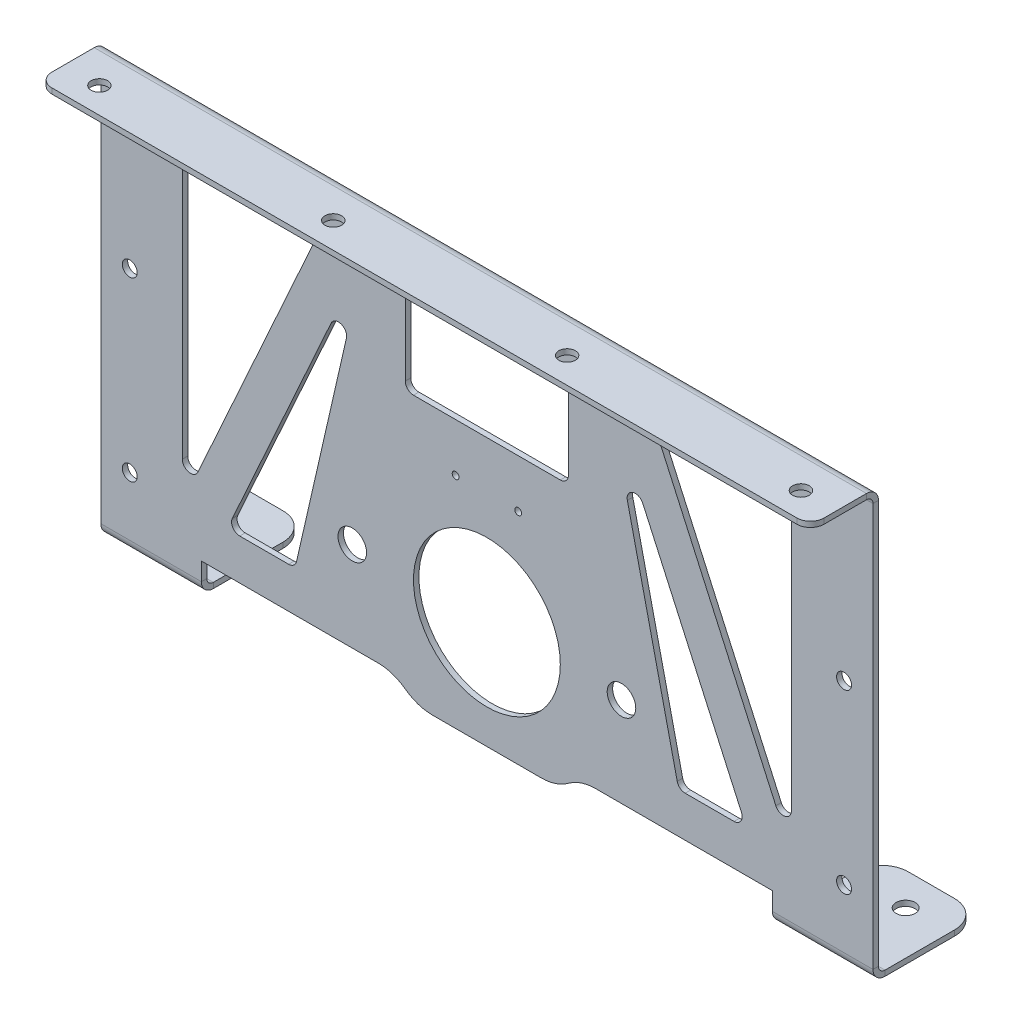
from build123d import *

# Parameters (mm, degrees)
SM_START                     = -142
SM_BASE_FLANGE_1_DEPTH       = 284
SKETCH_6_R                   = 27
CUT_EXTRUDE_1_DEPTH          = 10
HOLE_WIZARD_5_5_5_5_1_D      = 5.5
HOLE_WIZARD_5_5_5_5_1_DEPTH  = 14
HOLE_WIZARD_5_5_5_5_1_TIP    = 1.652366702
HOLE_WIZARD_7_0_7_1_D        = 7
SKETCH_21_W                  = 210
SKETCH_21_H                  = 11
CUT_EXTRUDE_4_DEPTH          = 213.395480178
FILLET_1_R                   = 10
HOLE_WIZARD_M31_D            = 2.5
HOLE_WIZARD_M31_DEPTH        = 8.5
HOLE_WIZARD_M31_TIP          = 0.751075774
SM_EDGE_FLANGE_1_DEPTH       = 284
FILLET_3_R                   = 5
EXTRUDE_1_DEPTH              = 2
CUT_EXTRUDE_5_DEPTH          = 10
HOLE_WIZARD_6_1_6_1_1_D      = 6.1
HOLE_WIZARD_6_1_6_1_1_DEPTH  = 7.25
HOLE_WIZARD_6_1_6_1_1_TIP    = 1.832624888
F_10_5_10_5_DIAMETER_HOLE1_D = 10.5


# Read off the part's stored shape, not the designer's step: Базовая кромка1
# Sheet-metal steps are written as plain solids
with BuildPart() as part:
    # Базовая кромка1 outline → Базовая кромка1 (new body)
    with BuildSketch(Plane(origin=(0, 0, 0), x_dir=(0, 0, -1), z_dir=(1, 0, 0)).offset(SM_START)):
        with BuildLine():
            Line((4.4, 0), (40, 0))
            Line((40, 0), (40, 2))
            Line((40, 2), (4.4, 2))
            ThreePointArc((4.4, 2), (2.702943725, 2.702943725), (2, 4.4))
            Line((2, 4.4), (2, 152.8))
            Line((2, 152.8), (0, 152.8))
            Line((0, 152.8), (0, 4.4))
            ThreePointArc((0, 4.4), (1.288730163, 1.288730163), (4.4, 0))
        make_face()
    extrude(amount=SM_BASE_FLANGE_1_DEPTH)

    # Эскиз6 → Вырез-Вытянуть1 (cut)
    with BuildSketch(Plane.XY):
        with Locations((0, 44)):
            Circle(SKETCH_6_R)
    extrude(amount=-CUT_EXTRUDE_1_DEPTH, mode=Mode.SUBTRACT)

    # Диаметр отверстия Ø5.5 (5.5)1
    with Locations(Plane.XY):
        with Locations((131.35, 91), (-131.35, 91), (-131.35, 26), (131.35, 26)):
            Hole(HOLE_WIZARD_5_5_5_5_1_D / 2, depth=HOLE_WIZARD_5_5_5_5_1_DEPTH)
            with Locations((0, 0, -(HOLE_WIZARD_5_5_5_5_1_DEPTH + HOLE_WIZARD_5_5_5_5_1_TIP / 2))):  # 118° drill point
                Cone(0, HOLE_WIZARD_5_5_5_5_1_D / 2, HOLE_WIZARD_5_5_5_5_1_TIP, mode=Mode.SUBTRACT)

    # Диаметр отверстия Ø7.0 (7)1 (through all)
    with Locations(Plane(origin=(0, 0, 0), x_dir=(-1, 0, 0), z_dir=(0, -1, 0))):
        with Locations((126, 28), (126, 13), (-126, 13), (-126, 28)):
            Hole(HOLE_WIZARD_7_0_7_1_D / 2)

    # Эскиз21 → Вырез-Вытянуть4 (cut, through all)
    with BuildSketch(Plane.XY):
        with Locations((0, 5.5)):
            Rectangle(SKETCH_21_W, SKETCH_21_H)
    extrude(amount=-CUT_EXTRUDE_4_DEPTH, mode=Mode.SUBTRACT)

    # Скругление1
    fillet_1_edges = [part.edges().sort_by_distance(p)[0] for p in [
        (-105, 1, -40),
        (105, 1, -40),
        (142, 1, -40),
        (-142, 1, -40),
    ]]
    fillet(fillet_1_edges, radius=FILLET_1_R)

    # Отверстие обработанное метчиком M31
    with Locations(Plane.XY):
        with Locations((-11.5, 85), (11.5, 85)):
            Hole(HOLE_WIZARD_M31_D / 2, depth=HOLE_WIZARD_M31_DEPTH)
            with Locations((0, 0, -(HOLE_WIZARD_M31_DEPTH + HOLE_WIZARD_M31_TIP / 2))):  # 118° drill point
                Cone(0, HOLE_WIZARD_M31_D / 2, HOLE_WIZARD_M31_TIP, mode=Mode.SUBTRACT)

    # Ребро-кромка1 section (across the edge) → Ребро-кромка1 (add)
    with BuildSketch(Plane(origin=(142, 155.2, 0), x_dir=(0, -1, 0), z_dir=(-1, 0, 0))):
        with BuildLine():
            Line((-2, 2.4), (-2, 23))
            Line((-2, 23), (0, 23))
            Line((0, 23), (0, 2.4))
            ThreePointArc((0, 2.4), (0.702943725, 0.702943725), (2.4, 0))
            Line((2.4, 0), (2.4, -2))
            ThreePointArc((2.4, -2), (-0.711269837, -0.711269837), (-2, 2.4))
        make_face()
    extrude(amount=SM_EDGE_FLANGE_1_DEPTH)

    # Скругление3
    fillet_3_edges = [part.edges().sort_by_distance(p)[0] for p in [
        (142, 156.2, 23),
        (-142, 156.2, 23),
    ]]
    fillet(fillet_3_edges, radius=FILLET_3_R)

    # Эскиз27 → Бобышка-Вытянуть1 (add)
    with BuildSketch(Plane.XY):
        with BuildLine():
            Line((40, 11), (-40, 11))
            ThreePointArc((-40, 11), (-34.734783955, 10.153684985), (-30, 7.7))
            ThreePointArc((-30, 7.7), (-25.265216045, 5.246315015), (-20, 4.4))
            Line((-20, 4.4), (20, 4.4))
            ThreePointArc((20, 4.4), (25.265216045, 5.246315015), (30, 7.7))
            ThreePointArc((30, 7.7), (34.734783955, 10.153684985), (40, 11))
        make_face()
    extrude(amount=-EXTRUDE_1_DEPTH)

    # Эскиз28 → Вырез-Вытянуть5 (cut)
    with BuildSketch(Plane.XY):
        with BuildLine():
            Line((-112, 134.8), (-112, 39.919592204))
            ThreePointArc((-112, 39.919592204), (-109.632057622, 36.986930757), (-106.266331225, 38.683851525))
            Line((-106.266331225, 38.683851525), (-63.376138879, 133.564259321))
            ThreePointArc((-63.376138879, 133.564259321), (-63.589170628, 136.426772566), (-66.109807654, 137.8))
            Line((-66.109807654, 137.8), (-109, 137.8))
            ThreePointArc((-109, 137.8), (-111.121320344, 136.921320344), (-112, 134.8))
        make_face()
        with BuildLine():
            Line((-90.890192346, 26), (-72.924698752, 26))
            ThreePointArc((-72.924698752, 26), (-71.054378606, 26.65438653), (-70, 28.332064967))
            Line((-70, 28.332064967), (-51.656189361, 108.654427819))
            ThreePointArc((-51.656189361, 108.654427819), (-53.624269894, 112.16575547), (-57.314556889, 110.558103531))
            Line((-57.314556889, 110.558103531), (-93.623861121, 30.235740679))
            ThreePointArc((-93.623861121, 30.235740679), (-93.410829372, 27.373227434), (-90.890192346, 26))
        make_face()
        with BuildLine():
            Line((-27, 137.8), (27, 137.8))
            ThreePointArc((27, 137.8), (29.121320344, 136.921320344), (30, 134.8))
            Line((30, 134.8), (30, 105.8))
            ThreePointArc((30, 105.8), (29.121320344, 103.678679656), (27, 102.8))
            Line((27, 102.8), (-27, 102.8))
            ThreePointArc((-27, 102.8), (-29.121320344, 103.678679656), (-30, 105.8))
            Line((-30, 105.8), (-30, 134.8))
            ThreePointArc((-30, 134.8), (-29.121320344, 136.921320344), (-27, 137.8))
        make_face()
        with BuildLine():
            Line((70, 28.332064967), (51.656189361, 108.654427819))
            ThreePointArc((51.656189361, 108.654427819), (53.624269894, 112.16575547), (57.314556889, 110.558103531))
            Line((57.314556889, 110.558103531), (93.623861121, 30.235740679))
            ThreePointArc((93.623861121, 30.235740679), (93.410829372, 27.373227434), (90.890192346, 26))
            Line((90.890192346, 26), (72.924698752, 26))
            ThreePointArc((72.924698752, 26), (71.054378606, 26.65438653), (70, 28.332064967))
        make_face()
        with BuildLine():
            Line((112, 134.8), (112, 39.919592204))
            ThreePointArc((112, 39.919592204), (109.632057622, 36.986930757), (106.266331225, 38.683851525))
            Line((106.266331225, 38.683851525), (63.376138879, 133.564259321))
            ThreePointArc((63.376138879, 133.564259321), (63.589170628, 136.426772566), (66.109807654, 137.8))
            Line((66.109807654, 137.8), (109, 137.8))
            ThreePointArc((109, 137.8), (111.121320344, 136.921320344), (112, 134.8))
        make_face()
    extrude(amount=-CUT_EXTRUDE_5_DEPTH, mode=Mode.SUBTRACT)

    # Диаметр отверстия Ø6.1 (6.1)1
    with Locations(Plane(origin=(0, 157.2, 0), x_dir=(1, 0, 0), z_dir=(0, 1, 0))):
        with Locations((-129, -13.5), (-43, -13.5), (43, -13.5), (129, -13.5)):
            Hole(HOLE_WIZARD_6_1_6_1_1_D / 2, depth=HOLE_WIZARD_6_1_6_1_1_DEPTH)
            with Locations((0, 0, -(HOLE_WIZARD_6_1_6_1_1_DEPTH + HOLE_WIZARD_6_1_6_1_1_TIP / 2))):  # 118° drill point
                Cone(0, HOLE_WIZARD_6_1_6_1_1_D / 2, HOLE_WIZARD_6_1_6_1_1_TIP, mode=Mode.SUBTRACT)

    # Ø10.5 (10.5) Diameter Hole1 (through all)
    with Locations(Plane.XY):
        with Locations((-49.5, 44), (49.5, 44)):
            Hole(F_10_5_10_5_DIAMETER_HOLE1_D / 2)


solid = part.part
